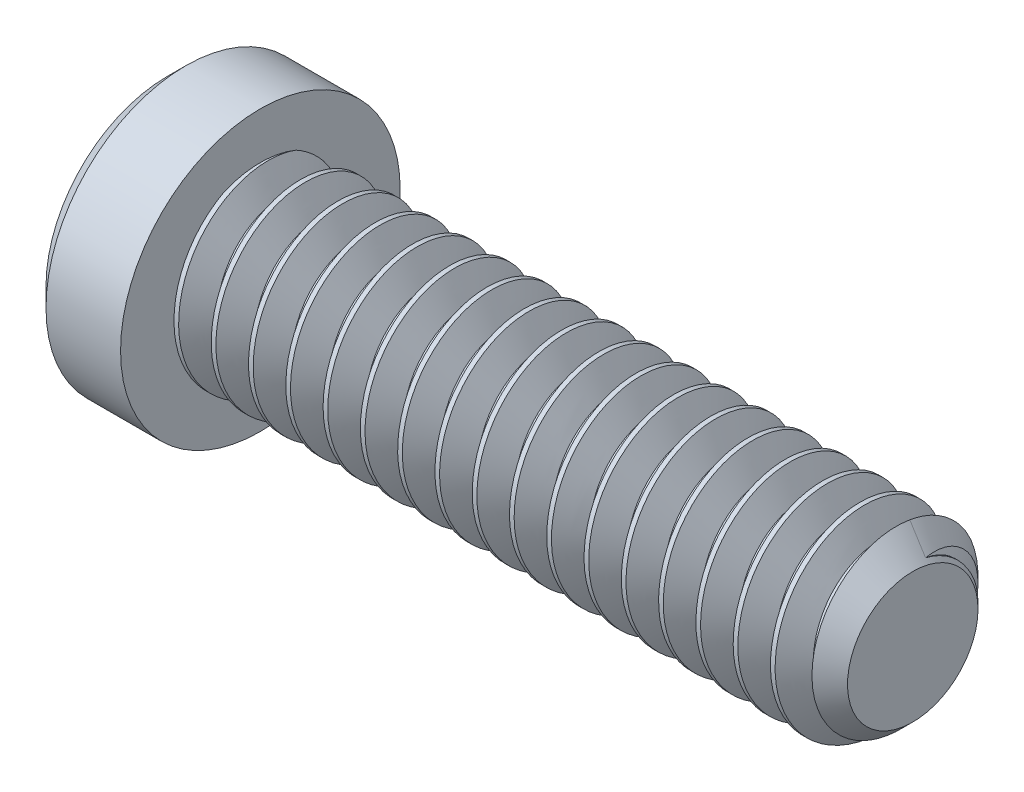
from build123d import *

# Parameters (mm, degrees)
SKETCH2_R           = 3.175
BOSS_EXTRUDE1_DEPTH = 22.225
CHAMFER1_SIZE       = 0.9525
CUT_SWEEP1_PITCH    = 1.27
CUT_EXTRUDE1_DEPTH  = 2.3876


with BuildPart() as part:
    # Sketch2 → Boss-Extrude1 (new body)
    with BuildSketch(Plane(origin=(11.1125, 0, 0), x_dir=(0, 0, -1), z_dir=(1, 0, 0))):
        Circle(SKETCH2_R)
    extrude(amount=-BOSS_EXTRUDE1_DEPTH)

    # Chamfer1
    chamfer1_edges = [part.edges().sort_by_distance(p)[0] for p in [
        (11.1125, 0, 3.175),
    ]]
    chamfer(chamfer1_edges, length=CHAMFER1_SIZE)

    # Cut-Sweep1: the profile of Sketch5 profile screwed along a right-hand helix of 18.5 turns, 8 arcs to a turn; built about Z, then put on its axis
    cut_sweep1_z = Axis((0, 0, 0), (0, 0, 1))
    cut_sweep1_corners = [(3.1753, 0, 0.555798205), (3.1753, 0, -0.555798205), (2.350110803, 0, -0.079375), (2.350110803, 0, 0.079375)]
    with BuildLine(mode=Mode.PRIVATE) as cut_sweep1_profile:
        Line(cut_sweep1_corners[0], cut_sweep1_corners[1])
        Line(cut_sweep1_corners[1], cut_sweep1_corners[2])
        Line(cut_sweep1_corners[2], cut_sweep1_corners[3])
        Line(cut_sweep1_corners[3], cut_sweep1_corners[0])
    cut_sweep1_cap = Face(cut_sweep1_profile.wire())
    cut_sweep1_turn_angles = [0, 22.5, 45, 67.5, 90, 112.5, 135, 157.5, 180, 202.5, 225, 247.5, 270, 292.5, 315, 337.5, 360]
    cut_sweep1_turn_weights = [1, 0.9238795325112867, 1, 0.9238795325112867, 1, 0.9238795325112867, 1, 0.9238795325112867, 1, 0.9238795325112867, 1, 0.9238795325112867, 1, 0.9238795325112867, 1, 0.9238795325112867, 1]
    cut_sweep1_turn_rails = [Edge.make_bspline([Vector(p[0], p[1], 0).rotate(cut_sweep1_z, cut_sweep1_turn_angles[k]) / cut_sweep1_turn_weights[k] + Vector(0, 0, p[2] + CUT_SWEEP1_PITCH * cut_sweep1_turn_angles[k] / 360) for k in range(17)], [0, 0, 0, 1, 1, 2, 2, 3, 3, 4, 4, 5, 5, 6, 6, 7, 7, 8, 8, 8], 2, cut_sweep1_turn_weights) for p in cut_sweep1_corners]
    cut_sweep1_turn_sides = [Face.make_surface_from_curves(cut_sweep1_turn_rails[p[0]], cut_sweep1_turn_rails[p[1]]) for p in [(0, 1), (1, 2), (2, 3), (3, 0)]]
    cut_sweep1_last_angles = [6480, 6502.5, 6525, 6547.5, 6570, 6592.5, 6615, 6637.5, 6660]
    cut_sweep1_last_weights = [1, 0.9238795325112867, 1, 0.9238795325112867, 1, 0.9238795325112867, 1, 0.9238795325112381, 1]
    cut_sweep1_last_rails = [Edge.make_bspline([Vector(p[0], p[1], 0).rotate(cut_sweep1_z, cut_sweep1_last_angles[k]) / cut_sweep1_last_weights[k] + Vector(0, 0, p[2] + CUT_SWEEP1_PITCH * cut_sweep1_last_angles[k] / 360) for k in range(9)], [0, 0, 0, 1, 1, 2, 2, 3, 3, 4, 4, 4], 2, cut_sweep1_last_weights) for p in cut_sweep1_corners]
    cut_sweep1_last_sides = [Face.make_surface_from_curves(cut_sweep1_last_rails[p[0]], cut_sweep1_last_rails[p[1]]) for p in [(0, 1), (1, 2), (2, 3), (3, 0)]]
    cut_sweep1 = Plane(origin=(11.1125, 0, 0), x_dir=(0, 1, 0), z_dir=(-1, 0, 0)) * Solid(Shell([*[p.moved(Location((0, 0, CUT_SWEEP1_PITCH * i))) for i in range(18) for p in cut_sweep1_turn_sides], *cut_sweep1_last_sides, cut_sweep1_cap, cut_sweep1_cap.rotate(cut_sweep1_z, 6660).moved(Location((0, 0, CUT_SWEEP1_PITCH * 6660 / 360)))]))
    add(cut_sweep1, mode=Mode.SUBTRACT)

    # Sketch6 → Revolve1 (revolve)
    with BuildSketch(Plane.XY, mode=Mode.PRIVATE) as revolve1_sk:
        Polygon((-13.6525, 4.7625), (-14.2875, 4.1275), (-14.2875, 0), (-11.1125, 0), (-11.1125, 4.7625), align=None)
    revolve(revolve1_sk.sketch.rotate(Axis((-11.1125, 0, 0), (-1, 0, 0)), 13.865622854), axis=Axis((-11.1125, 0, 0), (-1, 0, 0)))

    # Sketch4 → Cut-Extrude1 (cut)
    with BuildSketch(Plane(origin=(-14.2875, 0, 0), x_dir=(0, 0, -1), z_dir=(1, 0, 0))):
        Polygon((0, 1.833087105), (-1.5875, 0.916543552), (-1.5875, -0.916543552), (0, -1.833087105), (1.5875, -0.916543552), (1.5875, 0.916543552), align=None)
    extrude(amount=CUT_EXTRUDE1_DEPTH, mode=Mode.SUBTRACT)

    # Cut-Extrude2 cone 1 section (through the dimple's axis) → Cut-Extrude2 (revolve, cut)
    with BuildSketch(Plane(origin=(-14.2875, 0, 0), x_dir=(0, 0, 1), z_dir=(0, 1, 0))):
        Polygon((0, 0), (1.833087105, 0), (0, 1.833087105), align=None)
    revolve(axis=Axis((-14.2875, 0, 0), (1, 0, 0)), mode=Mode.SUBTRACT)


solid = part.part
